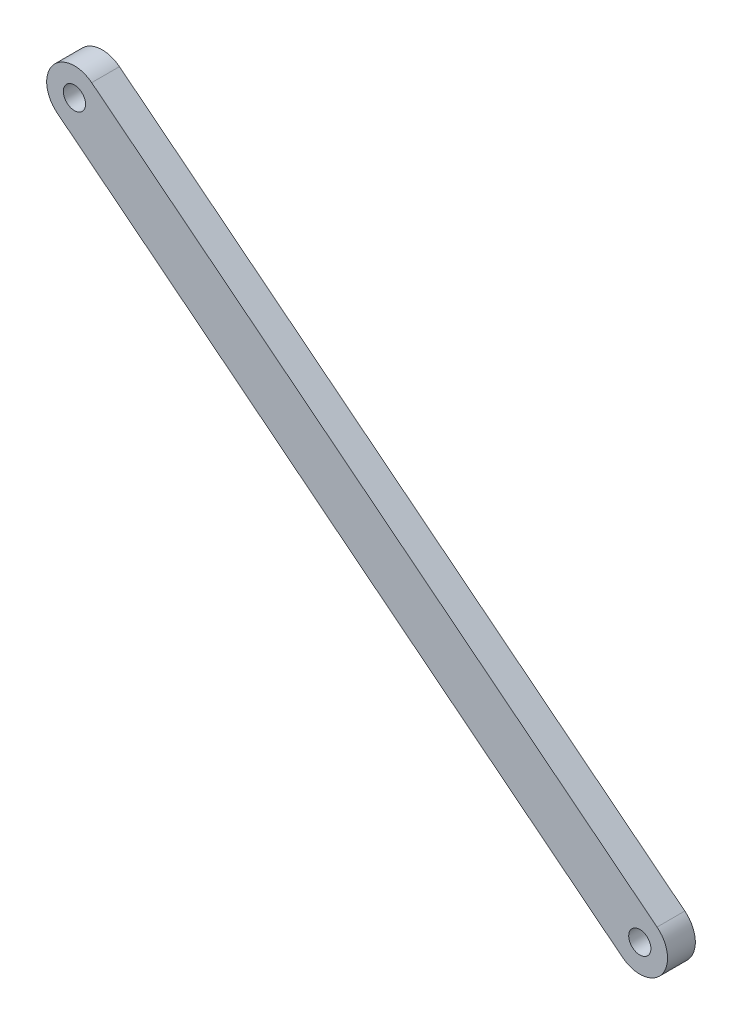
from build123d import *

# Parameters (mm, degrees)
BOSS_EXTRUDE1_START = 5
SKETCH1_R           = 2
BOSS_EXTRUDE1_DEPTH = 5


with BuildPart() as part:
    # Sketch1 → Boss-Extrude1 (new body)
    with BuildSketch(Plane.XY.offset(BOSS_EXTRUDE1_START)):
        with BuildLine():
            Line((-127.9861523, 136.915985083), (-26.146072776, 56.116243732))
            ThreePointArc((-26.146072776, 56.116243732), (-25.336829, 49.091635236), (-32.361437495, 48.28239146))
            Line((-32.361437495, 48.28239146), (-134.20151702, 129.082132812))
            ThreePointArc((-134.20151702, 129.082132812), (-135.010760796, 136.106741307), (-127.9861523, 136.915985083))
        make_face()
        with Locations((-29.253755136, 52.199317596)):
            Circle(SKETCH1_R, mode=Mode.SUBTRACT)
        with Locations((-131.09383466, 132.999058947)):
            Circle(SKETCH1_R, mode=Mode.SUBTRACT)
    extrude(amount=BOSS_EXTRUDE1_DEPTH)


solid = part.part
